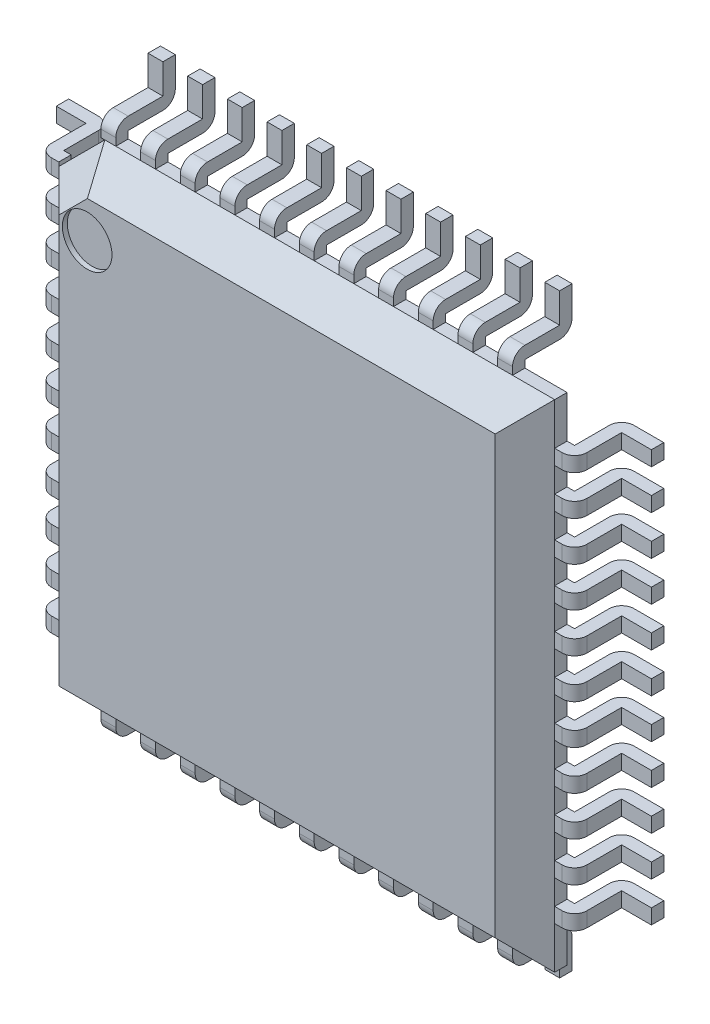
from build123d import *

# Parameters (mm, degrees)
EXTRUDE_1_DEPTH                = 1.45
CUT_EXTRUDE_1_DEPTH            = 8.218206148
SKETCH_3_R                     = 0.5
CUT_EXTRUDE_2_DEPTH            = 0.1
CHAMFER_2_SIZE                 = 0.6
SKETCH_4_W                     = 0.3
SKETCH_4_H                     = 0.25
FILLET_1_R                     = 0.25
PATTERN_LINEAR_4_COUNT         = 6
PATTERN_LINEAR_4_PITCH         = 0.8
FILLET_1_OF_PATTERN_LINEAR_4_R = 0.25
MIRROR_START                   = 0.65
MIRROR_1_DEPTH                 = 0.3
MIRROR_START_2                 = 1.45
MIRROR_1_2_DEPTH               = 0.3
MIRROR_START_3                 = 2.25
MIRROR_1_3_DEPTH               = 0.3
MIRROR_START_4                 = 3.05
MIRROR_1_4_DEPTH               = 0.3
MIRROR_START_5                 = 3.85
MIRROR_1_5_DEPTH               = 0.3
MIRROR_START_6                 = -4.15
MIRROR_2_DEPTH                 = 0.3
MIRROR_START_7                 = -3.35
MIRROR_2_2_DEPTH               = 0.3
MIRROR_START_8                 = -2.55
MIRROR_2_3_DEPTH               = 0.3
MIRROR_START_9                 = -1.75
MIRROR_2_4_DEPTH               = 0.3
MIRROR_START_10                = -0.95
MIRROR_2_5_DEPTH               = 0.3
MIRROR_START_11                = -0.15
MIRROR_2_6_DEPTH               = 0.3
MIRROR_2_7_DEPTH               = 0.3
MIRROR_2_8_DEPTH               = 0.3
MIRROR_2_9_DEPTH               = 0.3
MIRROR_2_10_DEPTH              = 0.3
MIRROR_2_11_DEPTH              = 0.3
PATTERN_START                  = -4.15
PATTERN_CIRCULAR_1_DEPTH       = 0.3
PATTERN_START_2                = -3.35
PATTERN_CIRCULAR_1_2_DEPTH     = 0.3
PATTERN_START_3                = -2.55
PATTERN_CIRCULAR_1_3_DEPTH     = 0.3
PATTERN_START_4                = -1.75
PATTERN_CIRCULAR_1_4_DEPTH     = 0.3
PATTERN_START_5                = -0.95
PATTERN_CIRCULAR_1_5_DEPTH     = 0.3
PATTERN_START_6                = -0.15
PATTERN_CIRCULAR_1_6_DEPTH     = 0.3
PATTERN_START_7                = 0.65
PATTERN_CIRCULAR_1_7_DEPTH     = 0.3
PATTERN_START_8                = 1.45
PATTERN_CIRCULAR_1_8_DEPTH     = 0.3
PATTERN_START_9                = 2.25
PATTERN_CIRCULAR_1_9_DEPTH     = 0.3
PATTERN_START_10               = 3.05
PATTERN_CIRCULAR_1_10_DEPTH    = 0.3
PATTERN_START_11               = 3.85
PATTERN_CIRCULAR_1_11_DEPTH    = 0.3


# Read off the part's stored shape, not the designer's step: 镜向1, 镜向2, 阵列(圆周)1
with BuildPart() as part:
    # 草图1 → 凸台-拉伸1 (new body)
    with BuildSketch(Plane.XY):
        Polygon((-5, 5), (-5, 0), (-5, -5), (5, -5), (5, 0), (5, 5), align=None)
    extrude(amount=EXTRUDE_1_DEPTH)

    # 草图2 → 切除-拉伸1 (cut, through all)
    with BuildSketch(Plane.XY.offset(1.45)):
        Polygon((-5, 4.070653152), (-4.070653152, 5), (-5, 5), align=None)
    extrude(amount=-CUT_EXTRUDE_1_DEPTH, mode=Mode.SUBTRACT)

    # 草图3 → 切除-拉伸2 (cut)
    with BuildSketch(Plane.XY.offset(1.45)):
        with Locations((-3.827534367, 3.663932896)):
            Circle(SKETCH_3_R)
    extrude(amount=-CUT_EXTRUDE_2_DEPTH, mode=Mode.SUBTRACT)

    # 倒角2
    chamfer_2_edges = [part.edges().sort_by_distance(p)[0] for p in [
        (0, -5, 1.45),
        (5, -2.5, 1.45),
        (-5, -2.5, 0),
        (-5, -2.5, 1.45),
        (-4.535326576, 4.535326576, 1.45),
        (-4.535326576, 4.535326576, 0),
        (0.464673424, 5, 1.45),
        (5, -2.5, 0),
        (0, -5, 0),
        (0.464673424, 5, 0),
    ]]
    chamfer(chamfer_2_edges, length=CHAMFER_2_SIZE)

    # 扫描1: sweep along a path in 草图5
    with BuildLine(Plane(origin=(0, 0, 0), x_dir=(0, 0, -1), z_dir=(1, 0, 0))) as sweep_1_path:
        Line((-0.85, -5), (-0.85, -5.4))
        Line((-0.85, -5.4), (0.1, -5.4))
        Line((0.1, -5.4), (0.1, -6))
    # 草图4 → 扫描1 (sweep)
    with BuildSketch(Plane.XZ.offset(5)):
        with Locations((0, 0.725)):
            Rectangle(SKETCH_4_W, SKETCH_4_H)
    sweep_1 = sweep(path=sweep_1_path.line, transition=Transition.RIGHT)

    # 圆角1
    fillet_1_edges = [part.edges().sort_by_distance(p)[0] for p in [
        (0, -5.15, -0.35),
        (0, -5.4, 0.85),
    ]]
    fillet(fillet_1_edges, radius=FILLET_1_R)

    # 阵列(线性)4: 扫描1 ×6
    with Locations(*[(-i * PATTERN_LINEAR_4_PITCH, 0, 0) for i in range(1, PATTERN_LINEAR_4_COUNT)]):
        add(sweep_1)

    # 圆角1 of 阵列(线性)4
    fillet_1_of_pattern_linear_4_edges = [part.edges().sort_by_distance(p)[0] for p in [
        (-0.8, -5.15, -0.35),
        (-0.8, -5.4, 0.85),
        (-1.6, -5.15, -0.35),
        (-1.6, -5.4, 0.85),
        (-2.4, -5.15, -0.35),
        (-2.4, -5.4, 0.85),
        (-3.2, -5.15, -0.35),
        (-3.2, -5.4, 0.85),
        (-4, -5.15, -0.35),
        (-4, -5.4, 0.85),
    ]]
    fillet(fillet_1_of_pattern_linear_4_edges, radius=FILLET_1_OF_PATTERN_LINEAR_4_R)

    # 镜向1 outline → 镜向1 (add)
    with BuildSketch(Plane.YZ.offset(MIRROR_START)):
        with BuildLine():
            Line((-6, -0.1), (-6, -0.35))
            Line((-6, -0.35), (-5.4, -0.35))
            ThreePointArc((-5.4, -0.35), (-5.223223305, -0.276776695), (-5.15, -0.1))
            Line((-5.15, -0.1), (-5.15, 0.6))
            Line((-5.15, 0.6), (-5, 0.6))
            Line((-5, 0.6), (-5, 0.85))
            Line((-5, 0.85), (-5.15, 0.85))
            ThreePointArc((-5.15, 0.85), (-5.326776695, 0.776776695), (-5.4, 0.6))
            Line((-5.4, 0.6), (-5.4, -0.1))
            Line((-5.4, -0.1), (-6, -0.1))
        make_face()
    extrude(amount=MIRROR_1_DEPTH)

    # Mirror 1 2 outline → Mirror 1 2 (add)
    with BuildSketch(Plane.YZ.offset(MIRROR_START_2)):
        with BuildLine():
            Line((-6, -0.1), (-6, -0.35))
            Line((-6, -0.35), (-5.4, -0.35))
            ThreePointArc((-5.4, -0.35), (-5.223223305, -0.276776695), (-5.15, -0.1))
            Line((-5.15, -0.1), (-5.15, 0.6))
            Line((-5.15, 0.6), (-5, 0.6))
            Line((-5, 0.6), (-5, 0.85))
            Line((-5, 0.85), (-5.15, 0.85))
            ThreePointArc((-5.15, 0.85), (-5.326776695, 0.776776695), (-5.4, 0.6))
            Line((-5.4, 0.6), (-5.4, -0.1))
            Line((-5.4, -0.1), (-6, -0.1))
        make_face()
    extrude(amount=MIRROR_1_2_DEPTH)

    # Mirror 1 3 outline → Mirror 1 3 (add)
    with BuildSketch(Plane.YZ.offset(MIRROR_START_3)):
        with BuildLine():
            Line((-6, -0.1), (-6, -0.35))
            Line((-6, -0.35), (-5.4, -0.35))
            ThreePointArc((-5.4, -0.35), (-5.223223305, -0.276776695), (-5.15, -0.1))
            Line((-5.15, -0.1), (-5.15, 0.6))
            Line((-5.15, 0.6), (-5, 0.6))
            Line((-5, 0.6), (-5, 0.85))
            Line((-5, 0.85), (-5.15, 0.85))
            ThreePointArc((-5.15, 0.85), (-5.326776695, 0.776776695), (-5.4, 0.6))
            Line((-5.4, 0.6), (-5.4, -0.1))
            Line((-5.4, -0.1), (-6, -0.1))
        make_face()
    extrude(amount=MIRROR_1_3_DEPTH)

    # Mirror 1 4 outline → Mirror 1 4 (add)
    with BuildSketch(Plane.YZ.offset(MIRROR_START_4)):
        with BuildLine():
            Line((-6, -0.1), (-6, -0.35))
            Line((-6, -0.35), (-5.4, -0.35))
            ThreePointArc((-5.4, -0.35), (-5.223223305, -0.276776695), (-5.15, -0.1))
            Line((-5.15, -0.1), (-5.15, 0.6))
            Line((-5.15, 0.6), (-5, 0.6))
            Line((-5, 0.6), (-5, 0.85))
            Line((-5, 0.85), (-5.15, 0.85))
            ThreePointArc((-5.15, 0.85), (-5.326776695, 0.776776695), (-5.4, 0.6))
            Line((-5.4, 0.6), (-5.4, -0.1))
            Line((-5.4, -0.1), (-6, -0.1))
        make_face()
    extrude(amount=MIRROR_1_4_DEPTH)

    # Mirror 1 5 outline → Mirror 1 5 (add)
    with BuildSketch(Plane.YZ.offset(MIRROR_START_5)):
        with BuildLine():
            Line((-6, -0.1), (-6, -0.35))
            Line((-6, -0.35), (-5.4, -0.35))
            ThreePointArc((-5.4, -0.35), (-5.223223305, -0.276776695), (-5.15, -0.1))
            Line((-5.15, -0.1), (-5.15, 0.6))
            Line((-5.15, 0.6), (-5, 0.6))
            Line((-5, 0.6), (-5, 0.85))
            Line((-5, 0.85), (-5.15, 0.85))
            ThreePointArc((-5.15, 0.85), (-5.326776695, 0.776776695), (-5.4, 0.6))
            Line((-5.4, 0.6), (-5.4, -0.1))
            Line((-5.4, -0.1), (-6, -0.1))
        make_face()
    extrude(amount=MIRROR_1_5_DEPTH)

    # 镜向2 outline → 镜向2 (add)
    with BuildSketch(Plane.YZ.offset(MIRROR_START_6)):
        with BuildLine():
            ThreePointArc((5.15, -0.1), (5.223223305, -0.276776695), (5.4, -0.35))
            Line((5.4, -0.35), (6, -0.35))
            Line((6, -0.35), (6, -0.1))
            Line((6, -0.1), (5.4, -0.1))
            Line((5.4, -0.1), (5.4, 0.6))
            ThreePointArc((5.4, 0.6), (5.326776695, 0.776776695), (5.15, 0.85))
            Line((5.15, 0.85), (5, 0.85))
            Line((5, 0.85), (5, 0.6))
            Line((5, 0.6), (5.15, 0.6))
            Line((5.15, 0.6), (5.15, -0.1))
        make_face()
    extrude(amount=MIRROR_2_DEPTH)

    # Mirror 2 2 outline → Mirror 2 2 (add)
    with BuildSketch(Plane.YZ.offset(MIRROR_START_7)):
        with BuildLine():
            ThreePointArc((5.15, -0.1), (5.223223305, -0.276776695), (5.4, -0.35))
            Line((5.4, -0.35), (6, -0.35))
            Line((6, -0.35), (6, -0.1))
            Line((6, -0.1), (5.4, -0.1))
            Line((5.4, -0.1), (5.4, 0.6))
            ThreePointArc((5.4, 0.6), (5.326776695, 0.776776695), (5.15, 0.85))
            Line((5.15, 0.85), (5, 0.85))
            Line((5, 0.85), (5, 0.6))
            Line((5, 0.6), (5.15, 0.6))
            Line((5.15, 0.6), (5.15, -0.1))
        make_face()
    extrude(amount=MIRROR_2_2_DEPTH)

    # Mirror 2 3 outline → Mirror 2 3 (add)
    with BuildSketch(Plane.YZ.offset(MIRROR_START_8)):
        with BuildLine():
            ThreePointArc((5.15, -0.1), (5.223223305, -0.276776695), (5.4, -0.35))
            Line((5.4, -0.35), (6, -0.35))
            Line((6, -0.35), (6, -0.1))
            Line((6, -0.1), (5.4, -0.1))
            Line((5.4, -0.1), (5.4, 0.6))
            ThreePointArc((5.4, 0.6), (5.326776695, 0.776776695), (5.15, 0.85))
            Line((5.15, 0.85), (5, 0.85))
            Line((5, 0.85), (5, 0.6))
            Line((5, 0.6), (5.15, 0.6))
            Line((5.15, 0.6), (5.15, -0.1))
        make_face()
    extrude(amount=MIRROR_2_3_DEPTH)

    # Mirror 2 4 outline → Mirror 2 4 (add)
    with BuildSketch(Plane.YZ.offset(MIRROR_START_9)):
        with BuildLine():
            ThreePointArc((5.15, -0.1), (5.223223305, -0.276776695), (5.4, -0.35))
            Line((5.4, -0.35), (6, -0.35))
            Line((6, -0.35), (6, -0.1))
            Line((6, -0.1), (5.4, -0.1))
            Line((5.4, -0.1), (5.4, 0.6))
            ThreePointArc((5.4, 0.6), (5.326776695, 0.776776695), (5.15, 0.85))
            Line((5.15, 0.85), (5, 0.85))
            Line((5, 0.85), (5, 0.6))
            Line((5, 0.6), (5.15, 0.6))
            Line((5.15, 0.6), (5.15, -0.1))
        make_face()
    extrude(amount=MIRROR_2_4_DEPTH)

    # Mirror 2 5 outline → Mirror 2 5 (add)
    with BuildSketch(Plane.YZ.offset(MIRROR_START_10)):
        with BuildLine():
            ThreePointArc((5.15, -0.1), (5.223223305, -0.276776695), (5.4, -0.35))
            Line((5.4, -0.35), (6, -0.35))
            Line((6, -0.35), (6, -0.1))
            Line((6, -0.1), (5.4, -0.1))
            Line((5.4, -0.1), (5.4, 0.6))
            ThreePointArc((5.4, 0.6), (5.326776695, 0.776776695), (5.15, 0.85))
            Line((5.15, 0.85), (5, 0.85))
            Line((5, 0.85), (5, 0.6))
            Line((5, 0.6), (5.15, 0.6))
            Line((5.15, 0.6), (5.15, -0.1))
        make_face()
    extrude(amount=MIRROR_2_5_DEPTH)

    # Mirror 2 6 outline → Mirror 2 6 (add)
    with BuildSketch(Plane.YZ.offset(MIRROR_START_11)):
        with BuildLine():
            ThreePointArc((5.15, -0.1), (5.223223305, -0.276776695), (5.4, -0.35))
            Line((5.4, -0.35), (6, -0.35))
            Line((6, -0.35), (6, -0.1))
            Line((6, -0.1), (5.4, -0.1))
            Line((5.4, -0.1), (5.4, 0.6))
            ThreePointArc((5.4, 0.6), (5.326776695, 0.776776695), (5.15, 0.85))
            Line((5.15, 0.85), (5, 0.85))
            Line((5, 0.85), (5, 0.6))
            Line((5, 0.6), (5.15, 0.6))
            Line((5.15, 0.6), (5.15, -0.1))
        make_face()
    extrude(amount=MIRROR_2_6_DEPTH)

    # Mirror 2 7 outline → Mirror 2 7 (add)
    with BuildSketch(Plane.YZ.offset(MIRROR_START)):
        with BuildLine():
            ThreePointArc((5.15, -0.1), (5.223223305, -0.276776695), (5.4, -0.35))
            Line((5.4, -0.35), (6, -0.35))
            Line((6, -0.35), (6, -0.1))
            Line((6, -0.1), (5.4, -0.1))
            Line((5.4, -0.1), (5.4, 0.6))
            ThreePointArc((5.4, 0.6), (5.326776695, 0.776776695), (5.15, 0.85))
            Line((5.15, 0.85), (5, 0.85))
            Line((5, 0.85), (5, 0.6))
            Line((5, 0.6), (5.15, 0.6))
            Line((5.15, 0.6), (5.15, -0.1))
        make_face()
    extrude(amount=MIRROR_2_7_DEPTH)

    # Mirror 2 8 outline → Mirror 2 8 (add)
    with BuildSketch(Plane.YZ.offset(MIRROR_START_2)):
        with BuildLine():
            ThreePointArc((5.15, -0.1), (5.223223305, -0.276776695), (5.4, -0.35))
            Line((5.4, -0.35), (6, -0.35))
            Line((6, -0.35), (6, -0.1))
            Line((6, -0.1), (5.4, -0.1))
            Line((5.4, -0.1), (5.4, 0.6))
            ThreePointArc((5.4, 0.6), (5.326776695, 0.776776695), (5.15, 0.85))
            Line((5.15, 0.85), (5, 0.85))
            Line((5, 0.85), (5, 0.6))
            Line((5, 0.6), (5.15, 0.6))
            Line((5.15, 0.6), (5.15, -0.1))
        make_face()
    extrude(amount=MIRROR_2_8_DEPTH)

    # Mirror 2 9 outline → Mirror 2 9 (add)
    with BuildSketch(Plane.YZ.offset(MIRROR_START_3)):
        with BuildLine():
            ThreePointArc((5.15, -0.1), (5.223223305, -0.276776695), (5.4, -0.35))
            Line((5.4, -0.35), (6, -0.35))
            Line((6, -0.35), (6, -0.1))
            Line((6, -0.1), (5.4, -0.1))
            Line((5.4, -0.1), (5.4, 0.6))
            ThreePointArc((5.4, 0.6), (5.326776695, 0.776776695), (5.15, 0.85))
            Line((5.15, 0.85), (5, 0.85))
            Line((5, 0.85), (5, 0.6))
            Line((5, 0.6), (5.15, 0.6))
            Line((5.15, 0.6), (5.15, -0.1))
        make_face()
    extrude(amount=MIRROR_2_9_DEPTH)

    # Mirror 2 10 outline → Mirror 2 10 (add)
    with BuildSketch(Plane.YZ.offset(MIRROR_START_4)):
        with BuildLine():
            ThreePointArc((5.15, -0.1), (5.223223305, -0.276776695), (5.4, -0.35))
            Line((5.4, -0.35), (6, -0.35))
            Line((6, -0.35), (6, -0.1))
            Line((6, -0.1), (5.4, -0.1))
            Line((5.4, -0.1), (5.4, 0.6))
            ThreePointArc((5.4, 0.6), (5.326776695, 0.776776695), (5.15, 0.85))
            Line((5.15, 0.85), (5, 0.85))
            Line((5, 0.85), (5, 0.6))
            Line((5, 0.6), (5.15, 0.6))
            Line((5.15, 0.6), (5.15, -0.1))
        make_face()
    extrude(amount=MIRROR_2_10_DEPTH)

    # Mirror 2 11 outline → Mirror 2 11 (add)
    with BuildSketch(Plane.YZ.offset(MIRROR_START_5)):
        with BuildLine():
            ThreePointArc((5.15, -0.1), (5.223223305, -0.276776695), (5.4, -0.35))
            Line((5.4, -0.35), (6, -0.35))
            Line((6, -0.35), (6, -0.1))
            Line((6, -0.1), (5.4, -0.1))
            Line((5.4, -0.1), (5.4, 0.6))
            ThreePointArc((5.4, 0.6), (5.326776695, 0.776776695), (5.15, 0.85))
            Line((5.15, 0.85), (5, 0.85))
            Line((5, 0.85), (5, 0.6))
            Line((5, 0.6), (5.15, 0.6))
            Line((5.15, 0.6), (5.15, -0.1))
        make_face()
    extrude(amount=MIRROR_2_11_DEPTH)

    # 阵列(圆周)1 outline → 阵列(圆周)1 (add)
    with BuildSketch(Plane(origin=(0, 0, 0), x_dir=(1, 0, 0), z_dir=(0, 1, 0)).offset(PATTERN_START)):
        with BuildLine():
            ThreePointArc((-5.15, 0.1), (-5.223223305, 0.276776695), (-5.4, 0.35))
            Line((-5.4, 0.35), (-6, 0.35))
            Line((-6, 0.35), (-6, 0.1))
            Line((-6, 0.1), (-5.4, 0.1))
            Line((-5.4, 0.1), (-5.4, -0.6))
            ThreePointArc((-5.4, -0.6), (-5.326776695, -0.776776695), (-5.15, -0.85))
            Line((-5.15, -0.85), (-5, -0.85))
            Line((-5, -0.85), (-5, -0.6))
            Line((-5, -0.6), (-5.15, -0.6))
            Line((-5.15, -0.6), (-5.15, 0.1))
        make_face()
        with BuildLine():
            Line((6, 0.35), (5.4, 0.35))
            ThreePointArc((5.4, 0.35), (5.223223305, 0.276776695), (5.15, 0.1))
            Line((5.15, 0.1), (5.15, -0.6))
            Line((5.15, -0.6), (5, -0.6))
            Line((5, -0.6), (5, -0.85))
            Line((5, -0.85), (5.15, -0.85))
            ThreePointArc((5.15, -0.85), (5.326776695, -0.776776695), (5.4, -0.6))
            Line((5.4, -0.6), (5.4, 0.1))
            Line((5.4, 0.1), (6, 0.1))
            Line((6, 0.1), (6, 0.35))
        make_face()
    extrude(amount=PATTERN_CIRCULAR_1_DEPTH)

    # Pattern Circular 1 2 outline → Pattern Circular 1 2 (add)
    with BuildSketch(Plane(origin=(0, 0, 0), x_dir=(1, 0, 0), z_dir=(0, 1, 0)).offset(PATTERN_START_2)):
        with BuildLine():
            ThreePointArc((-5.15, 0.1), (-5.223223305, 0.276776695), (-5.4, 0.35))
            Line((-5.4, 0.35), (-6, 0.35))
            Line((-6, 0.35), (-6, 0.1))
            Line((-6, 0.1), (-5.4, 0.1))
            Line((-5.4, 0.1), (-5.4, -0.6))
            ThreePointArc((-5.4, -0.6), (-5.326776695, -0.776776695), (-5.15, -0.85))
            Line((-5.15, -0.85), (-5, -0.85))
            Line((-5, -0.85), (-5, -0.6))
            Line((-5, -0.6), (-5.15, -0.6))
            Line((-5.15, -0.6), (-5.15, 0.1))
        make_face()
        with BuildLine():
            Line((6, 0.35), (5.4, 0.35))
            ThreePointArc((5.4, 0.35), (5.223223305, 0.276776695), (5.15, 0.1))
            Line((5.15, 0.1), (5.15, -0.6))
            Line((5.15, -0.6), (5, -0.6))
            Line((5, -0.6), (5, -0.85))
            Line((5, -0.85), (5.15, -0.85))
            ThreePointArc((5.15, -0.85), (5.326776695, -0.776776695), (5.4, -0.6))
            Line((5.4, -0.6), (5.4, 0.1))
            Line((5.4, 0.1), (6, 0.1))
            Line((6, 0.1), (6, 0.35))
        make_face()
    extrude(amount=PATTERN_CIRCULAR_1_2_DEPTH)

    # Pattern Circular 1 3 outline → Pattern Circular 1 3 (add)
    with BuildSketch(Plane(origin=(0, 0, 0), x_dir=(1, 0, 0), z_dir=(0, 1, 0)).offset(PATTERN_START_3)):
        with BuildLine():
            ThreePointArc((-5.15, 0.1), (-5.223223305, 0.276776695), (-5.4, 0.35))
            Line((-5.4, 0.35), (-6, 0.35))
            Line((-6, 0.35), (-6, 0.1))
            Line((-6, 0.1), (-5.4, 0.1))
            Line((-5.4, 0.1), (-5.4, -0.6))
            ThreePointArc((-5.4, -0.6), (-5.326776695, -0.776776695), (-5.15, -0.85))
            Line((-5.15, -0.85), (-5, -0.85))
            Line((-5, -0.85), (-5, -0.6))
            Line((-5, -0.6), (-5.15, -0.6))
            Line((-5.15, -0.6), (-5.15, 0.1))
        make_face()
        with BuildLine():
            Line((6, 0.35), (5.4, 0.35))
            ThreePointArc((5.4, 0.35), (5.223223305, 0.276776695), (5.15, 0.1))
            Line((5.15, 0.1), (5.15, -0.6))
            Line((5.15, -0.6), (5, -0.6))
            Line((5, -0.6), (5, -0.85))
            Line((5, -0.85), (5.15, -0.85))
            ThreePointArc((5.15, -0.85), (5.326776695, -0.776776695), (5.4, -0.6))
            Line((5.4, -0.6), (5.4, 0.1))
            Line((5.4, 0.1), (6, 0.1))
            Line((6, 0.1), (6, 0.35))
        make_face()
    extrude(amount=PATTERN_CIRCULAR_1_3_DEPTH)

    # Pattern Circular 1 4 outline → Pattern Circular 1 4 (add)
    with BuildSketch(Plane(origin=(0, 0, 0), x_dir=(1, 0, 0), z_dir=(0, 1, 0)).offset(PATTERN_START_4)):
        with BuildLine():
            ThreePointArc((-5.15, 0.1), (-5.223223305, 0.276776695), (-5.4, 0.35))
            Line((-5.4, 0.35), (-6, 0.35))
            Line((-6, 0.35), (-6, 0.1))
            Line((-6, 0.1), (-5.4, 0.1))
            Line((-5.4, 0.1), (-5.4, -0.6))
            ThreePointArc((-5.4, -0.6), (-5.326776695, -0.776776695), (-5.15, -0.85))
            Line((-5.15, -0.85), (-5, -0.85))
            Line((-5, -0.85), (-5, -0.6))
            Line((-5, -0.6), (-5.15, -0.6))
            Line((-5.15, -0.6), (-5.15, 0.1))
        make_face()
        with BuildLine():
            Line((6, 0.35), (5.4, 0.35))
            ThreePointArc((5.4, 0.35), (5.223223305, 0.276776695), (5.15, 0.1))
            Line((5.15, 0.1), (5.15, -0.6))
            Line((5.15, -0.6), (5, -0.6))
            Line((5, -0.6), (5, -0.85))
            Line((5, -0.85), (5.15, -0.85))
            ThreePointArc((5.15, -0.85), (5.326776695, -0.776776695), (5.4, -0.6))
            Line((5.4, -0.6), (5.4, 0.1))
            Line((5.4, 0.1), (6, 0.1))
            Line((6, 0.1), (6, 0.35))
        make_face()
    extrude(amount=PATTERN_CIRCULAR_1_4_DEPTH)

    # Pattern Circular 1 5 outline → Pattern Circular 1 5 (add)
    with BuildSketch(Plane(origin=(0, 0, 0), x_dir=(1, 0, 0), z_dir=(0, 1, 0)).offset(PATTERN_START_5)):
        with BuildLine():
            ThreePointArc((-5.15, 0.1), (-5.223223305, 0.276776695), (-5.4, 0.35))
            Line((-5.4, 0.35), (-6, 0.35))
            Line((-6, 0.35), (-6, 0.1))
            Line((-6, 0.1), (-5.4, 0.1))
            Line((-5.4, 0.1), (-5.4, -0.6))
            ThreePointArc((-5.4, -0.6), (-5.326776695, -0.776776695), (-5.15, -0.85))
            Line((-5.15, -0.85), (-5, -0.85))
            Line((-5, -0.85), (-5, -0.6))
            Line((-5, -0.6), (-5.15, -0.6))
            Line((-5.15, -0.6), (-5.15, 0.1))
        make_face()
        with BuildLine():
            Line((6, 0.35), (5.4, 0.35))
            ThreePointArc((5.4, 0.35), (5.223223305, 0.276776695), (5.15, 0.1))
            Line((5.15, 0.1), (5.15, -0.6))
            Line((5.15, -0.6), (5, -0.6))
            Line((5, -0.6), (5, -0.85))
            Line((5, -0.85), (5.15, -0.85))
            ThreePointArc((5.15, -0.85), (5.326776695, -0.776776695), (5.4, -0.6))
            Line((5.4, -0.6), (5.4, 0.1))
            Line((5.4, 0.1), (6, 0.1))
            Line((6, 0.1), (6, 0.35))
        make_face()
    extrude(amount=PATTERN_CIRCULAR_1_5_DEPTH)

    # Pattern Circular 1 6 outline → Pattern Circular 1 6 (add)
    with BuildSketch(Plane(origin=(0, 0, 0), x_dir=(1, 0, 0), z_dir=(0, 1, 0)).offset(PATTERN_START_6)):
        with BuildLine():
            ThreePointArc((-5.15, 0.1), (-5.223223305, 0.276776695), (-5.4, 0.35))
            Line((-5.4, 0.35), (-6, 0.35))
            Line((-6, 0.35), (-6, 0.1))
            Line((-6, 0.1), (-5.4, 0.1))
            Line((-5.4, 0.1), (-5.4, -0.6))
            ThreePointArc((-5.4, -0.6), (-5.326776695, -0.776776695), (-5.15, -0.85))
            Line((-5.15, -0.85), (-5, -0.85))
            Line((-5, -0.85), (-5, -0.6))
            Line((-5, -0.6), (-5.15, -0.6))
            Line((-5.15, -0.6), (-5.15, 0.1))
        make_face()
        with BuildLine():
            Line((6, 0.35), (5.4, 0.35))
            ThreePointArc((5.4, 0.35), (5.223223305, 0.276776695), (5.15, 0.1))
            Line((5.15, 0.1), (5.15, -0.6))
            Line((5.15, -0.6), (5, -0.6))
            Line((5, -0.6), (5, -0.85))
            Line((5, -0.85), (5.15, -0.85))
            ThreePointArc((5.15, -0.85), (5.326776695, -0.776776695), (5.4, -0.6))
            Line((5.4, -0.6), (5.4, 0.1))
            Line((5.4, 0.1), (6, 0.1))
            Line((6, 0.1), (6, 0.35))
        make_face()
    extrude(amount=PATTERN_CIRCULAR_1_6_DEPTH)

    # Pattern Circular 1 7 outline → Pattern Circular 1 7 (add)
    with BuildSketch(Plane(origin=(0, 0, 0), x_dir=(1, 0, 0), z_dir=(0, 1, 0)).offset(PATTERN_START_7)):
        with BuildLine():
            ThreePointArc((-5.15, 0.1), (-5.223223305, 0.276776695), (-5.4, 0.35))
            Line((-5.4, 0.35), (-6, 0.35))
            Line((-6, 0.35), (-6, 0.1))
            Line((-6, 0.1), (-5.4, 0.1))
            Line((-5.4, 0.1), (-5.4, -0.6))
            ThreePointArc((-5.4, -0.6), (-5.326776695, -0.776776695), (-5.15, -0.85))
            Line((-5.15, -0.85), (-5, -0.85))
            Line((-5, -0.85), (-5, -0.6))
            Line((-5, -0.6), (-5.15, -0.6))
            Line((-5.15, -0.6), (-5.15, 0.1))
        make_face()
        with BuildLine():
            Line((6, 0.35), (5.4, 0.35))
            ThreePointArc((5.4, 0.35), (5.223223305, 0.276776695), (5.15, 0.1))
            Line((5.15, 0.1), (5.15, -0.6))
            Line((5.15, -0.6), (5, -0.6))
            Line((5, -0.6), (5, -0.85))
            Line((5, -0.85), (5.15, -0.85))
            ThreePointArc((5.15, -0.85), (5.326776695, -0.776776695), (5.4, -0.6))
            Line((5.4, -0.6), (5.4, 0.1))
            Line((5.4, 0.1), (6, 0.1))
            Line((6, 0.1), (6, 0.35))
        make_face()
    extrude(amount=PATTERN_CIRCULAR_1_7_DEPTH)

    # Pattern Circular 1 8 outline → Pattern Circular 1 8 (add)
    with BuildSketch(Plane(origin=(0, 0, 0), x_dir=(1, 0, 0), z_dir=(0, 1, 0)).offset(PATTERN_START_8)):
        with BuildLine():
            ThreePointArc((-5.15, 0.1), (-5.223223305, 0.276776695), (-5.4, 0.35))
            Line((-5.4, 0.35), (-6, 0.35))
            Line((-6, 0.35), (-6, 0.1))
            Line((-6, 0.1), (-5.4, 0.1))
            Line((-5.4, 0.1), (-5.4, -0.6))
            ThreePointArc((-5.4, -0.6), (-5.326776695, -0.776776695), (-5.15, -0.85))
            Line((-5.15, -0.85), (-5, -0.85))
            Line((-5, -0.85), (-5, -0.6))
            Line((-5, -0.6), (-5.15, -0.6))
            Line((-5.15, -0.6), (-5.15, 0.1))
        make_face()
        with BuildLine():
            Line((6, 0.35), (5.4, 0.35))
            ThreePointArc((5.4, 0.35), (5.223223305, 0.276776695), (5.15, 0.1))
            Line((5.15, 0.1), (5.15, -0.6))
            Line((5.15, -0.6), (5, -0.6))
            Line((5, -0.6), (5, -0.85))
            Line((5, -0.85), (5.15, -0.85))
            ThreePointArc((5.15, -0.85), (5.326776695, -0.776776695), (5.4, -0.6))
            Line((5.4, -0.6), (5.4, 0.1))
            Line((5.4, 0.1), (6, 0.1))
            Line((6, 0.1), (6, 0.35))
        make_face()
    extrude(amount=PATTERN_CIRCULAR_1_8_DEPTH)

    # Pattern Circular 1 9 outline → Pattern Circular 1 9 (add)
    with BuildSketch(Plane(origin=(0, 0, 0), x_dir=(1, 0, 0), z_dir=(0, 1, 0)).offset(PATTERN_START_9)):
        with BuildLine():
            ThreePointArc((-5.15, 0.1), (-5.223223305, 0.276776695), (-5.4, 0.35))
            Line((-5.4, 0.35), (-6, 0.35))
            Line((-6, 0.35), (-6, 0.1))
            Line((-6, 0.1), (-5.4, 0.1))
            Line((-5.4, 0.1), (-5.4, -0.6))
            ThreePointArc((-5.4, -0.6), (-5.326776695, -0.776776695), (-5.15, -0.85))
            Line((-5.15, -0.85), (-5, -0.85))
            Line((-5, -0.85), (-5, -0.6))
            Line((-5, -0.6), (-5.15, -0.6))
            Line((-5.15, -0.6), (-5.15, 0.1))
        make_face()
        with BuildLine():
            Line((6, 0.35), (5.4, 0.35))
            ThreePointArc((5.4, 0.35), (5.223223305, 0.276776695), (5.15, 0.1))
            Line((5.15, 0.1), (5.15, -0.6))
            Line((5.15, -0.6), (5, -0.6))
            Line((5, -0.6), (5, -0.85))
            Line((5, -0.85), (5.15, -0.85))
            ThreePointArc((5.15, -0.85), (5.326776695, -0.776776695), (5.4, -0.6))
            Line((5.4, -0.6), (5.4, 0.1))
            Line((5.4, 0.1), (6, 0.1))
            Line((6, 0.1), (6, 0.35))
        make_face()
    extrude(amount=PATTERN_CIRCULAR_1_9_DEPTH)

    # Pattern Circular 1 10 outline → Pattern Circular 1 10 (add)
    with BuildSketch(Plane(origin=(0, 0, 0), x_dir=(1, 0, 0), z_dir=(0, 1, 0)).offset(PATTERN_START_10)):
        with BuildLine():
            ThreePointArc((-5.15, 0.1), (-5.223223305, 0.276776695), (-5.4, 0.35))
            Line((-5.4, 0.35), (-6, 0.35))
            Line((-6, 0.35), (-6, 0.1))
            Line((-6, 0.1), (-5.4, 0.1))
            Line((-5.4, 0.1), (-5.4, -0.6))
            ThreePointArc((-5.4, -0.6), (-5.326776695, -0.776776695), (-5.15, -0.85))
            Line((-5.15, -0.85), (-5, -0.85))
            Line((-5, -0.85), (-5, -0.6))
            Line((-5, -0.6), (-5.15, -0.6))
            Line((-5.15, -0.6), (-5.15, 0.1))
        make_face()
        with BuildLine():
            Line((6, 0.35), (5.4, 0.35))
            ThreePointArc((5.4, 0.35), (5.223223305, 0.276776695), (5.15, 0.1))
            Line((5.15, 0.1), (5.15, -0.6))
            Line((5.15, -0.6), (5, -0.6))
            Line((5, -0.6), (5, -0.85))
            Line((5, -0.85), (5.15, -0.85))
            ThreePointArc((5.15, -0.85), (5.326776695, -0.776776695), (5.4, -0.6))
            Line((5.4, -0.6), (5.4, 0.1))
            Line((5.4, 0.1), (6, 0.1))
            Line((6, 0.1), (6, 0.35))
        make_face()
    extrude(amount=PATTERN_CIRCULAR_1_10_DEPTH)

    # Pattern Circular 1 11 outline → Pattern Circular 1 11 (add)
    with BuildSketch(Plane(origin=(0, 0, 0), x_dir=(1, 0, 0), z_dir=(0, 1, 0)).offset(PATTERN_START_11)):
        with BuildLine():
            ThreePointArc((-5.15, 0.1), (-5.223223305, 0.276776695), (-5.4, 0.35))
            Line((-5.4, 0.35), (-6, 0.35))
            Line((-6, 0.35), (-6, 0.1))
            Line((-6, 0.1), (-5.4, 0.1))
            Line((-5.4, 0.1), (-5.4, -0.6))
            ThreePointArc((-5.4, -0.6), (-5.326776695, -0.776776695), (-5.15, -0.85))
            Line((-5.15, -0.85), (-5, -0.85))
            Line((-5, -0.85), (-5, -0.6))
            Line((-5, -0.6), (-5.15, -0.6))
            Line((-5.15, -0.6), (-5.15, 0.1))
        make_face()
        with BuildLine():
            Line((6, 0.35), (5.4, 0.35))
            ThreePointArc((5.4, 0.35), (5.223223305, 0.276776695), (5.15, 0.1))
            Line((5.15, 0.1), (5.15, -0.6))
            Line((5.15, -0.6), (5, -0.6))
            Line((5, -0.6), (5, -0.85))
            Line((5, -0.85), (5.15, -0.85))
            ThreePointArc((5.15, -0.85), (5.326776695, -0.776776695), (5.4, -0.6))
            Line((5.4, -0.6), (5.4, 0.1))
            Line((5.4, 0.1), (6, 0.1))
            Line((6, 0.1), (6, 0.35))
        make_face()
    extrude(amount=PATTERN_CIRCULAR_1_11_DEPTH)


solid = part.part
